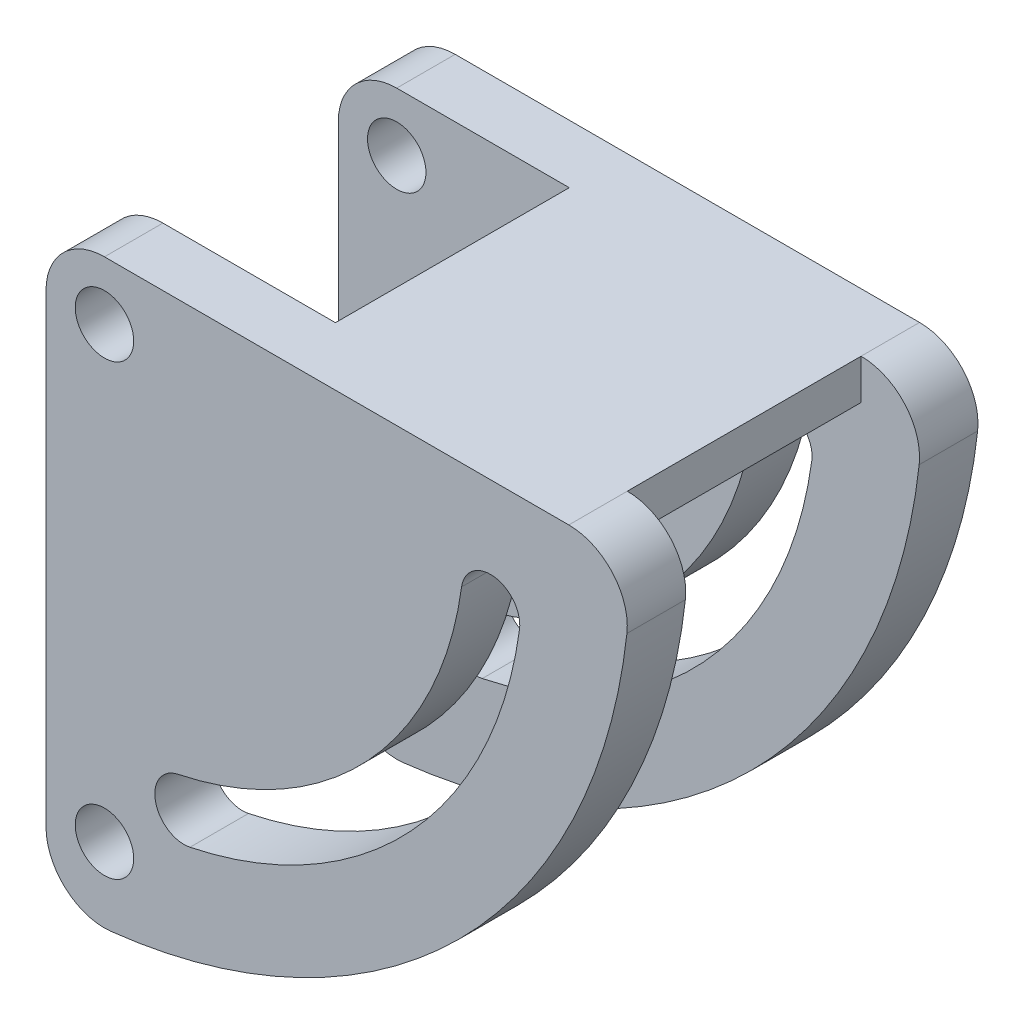
from build123d import *

# Parameters (mm, degrees)
SKETCH1_R           = 1.5
BOSS_EXTRUDE1_DEPTH = 3
LPATTERN1_COUNT     = 2
LPATTERN1_PITCH     = 15
FILLET2_R           = 3
FILLET3_R           = 3
BOSS_EXTRUDE2_REACH = 46.777
SKETCH2_W           = 14.977515773
SKETCH2_H           = 2.058823846


with BuildPart() as part:
    # Sketch1 → Boss-Extrude1 (new body)
    with BuildSketch(Plane.XY):
        with BuildLine():
            Line((0, 0), (30, 0))
            ThreePointArc((30, 0), (21.213203436, -21.213203436), (0, -30))
            Line((0, -30), (0, 0))
        make_face()
        with Locations((3, -26)):
            Circle(SKETCH1_R, mode=Mode.SUBTRACT)
        with Locations((3, -3)):
            Circle(SKETCH1_R, mode=Mode.SUBTRACT)
        with BuildLine():
            ThreePointArc((21.329556778, -5.505463694), (16.530007928, -15.617007786), (6.777863694, -21.110155878))
            ThreePointArc((6.777863694, -21.110155878), (5.61578595, -22.884860167), (7.390490239, -24.046937912))
            ThreePointArc((7.390490239, -24.046937912), (18.724063267, -17.663009049), (24.301917337, -5.911755103))
            ThreePointArc((24.301917337, -5.911755103), (23.018882762, -4.222429119), (21.329556778, -5.505463694))
        make_face(mode=Mode.SUBTRACT)
    extrude(amount=BOSS_EXTRUDE1_DEPTH)


with BuildPart() as lpattern1_1:
    # LPattern1: pattern copy
    add(part.part.moved(Location(Vector(0, 0, 1) * (1 * LPATTERN1_PITCH))))

    # Fillet3
    fillet3_edges = [lpattern1_1.edges().sort_by_distance(p)[0] for p in [
        (0, -30, 16.5),
        (0, 0, 16.5),
        (30, 0, 16.5),
    ]]
    fillet(fillet3_edges, radius=FILLET3_R)

    # Sketch2 → Boss-Extrude2 (add, up to next)
    with BuildSketch(Plane.XY.offset(3), mode=Mode.PRIVATE) as boss_extrude2_sk1:
        with Locations((19.344057843, -1.029411923)):
            Rectangle(SKETCH2_W, SKETCH2_H)
    boss_extrude2_tool1 = extrude(boss_extrude2_sk1.sketch, amount=BOSS_EXTRUDE2_REACH, mode=Mode.PRIVATE) - lpattern1_1.part


with BuildPart() as part_1:
    add(part.part)

    # Fillet2
    fillet2_edges = [part_1.edges().sort_by_distance(p)[0] for p in [
        (0, -30, 1.5),
        (0, 0, 1.5),
        (30, 0, 1.5),
    ]]
    fillet(fillet2_edges, radius=FILLET2_R)


with BuildPart() as lpattern1_1_1:
    add(lpattern1_1.part)

    add(part_1.part)  # Boss-Extrude2 merges part
    add(boss_extrude2_tool1.solids().sort_by_distance((19.344058, -1.029412, 3))[0])


solid = lpattern1_1_1.part
